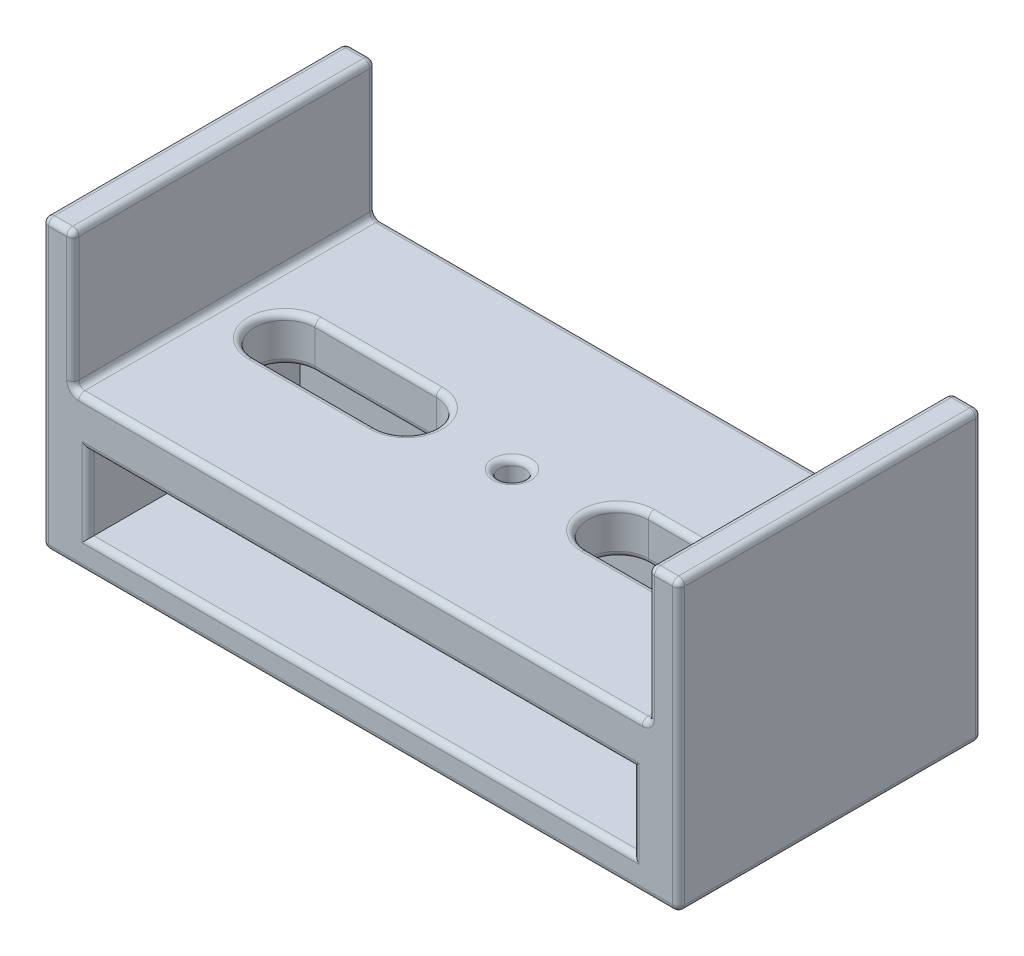
from build123d import *

# Parameters (mm, degrees)
SKETCH_1_W          = 210
SKETCH_1_H          = 100
EXTRUDE_1_DEPTH     = 50
CUT_EXTRUDE_1_DEPTH = 40
SKETCH_3_W          = 180
SKETCH_3_H          = 25
CUT_EXTRUDE_2_DEPTH = 70
SKETCH_4_R          = 4.25
CUT_EXTRUDE_3_DEPTH = 20
FILLET_4_R          = 2
SKETCH_6_W          = 10
SKETCH_6_H          = 100
EXTRUDE_2_DEPTH     = 45
FILLET_7_R          = 2


with BuildPart() as part:
    # 草图1 → 凸台-拉伸1 (new body)
    with BuildSketch(Plane(origin=(0, 0, 0), x_dir=(1, 0, 0), z_dir=(0, 1, 0))):
        with Locations((105, -50)):
            Rectangle(SKETCH_1_W, SKETCH_1_H)
    extrude(amount=EXTRUDE_1_DEPTH)

    # 草图2 → 切除-拉伸1 (cut)
    with BuildSketch(Plane(origin=(0, 50, 0), x_dir=(1, 0, 0), z_dir=(0, 1, 0))):
        with BuildLine():
            Line((30, -40), (70, -40))
            ThreePointArc((70, -40), (80, -50), (70, -60))
            Line((70, -60), (30, -60))
            ThreePointArc((30, -60), (20, -50), (30, -40))
        make_face()
        with BuildLine():
            Line((140, -40), (180, -40))
            ThreePointArc((180, -40), (190, -50), (180, -60))
            Line((180, -60), (140, -60))
            ThreePointArc((140, -60), (130, -50), (140, -40))
        make_face()
    extrude(amount=-CUT_EXTRUDE_1_DEPTH, mode=Mode.SUBTRACT)

    # 草图3 → 切除-拉伸2 (cut)
    with BuildSketch(Plane.XY.offset(100)):
        with Locations((105, 22.5)):
            Rectangle(SKETCH_3_W, SKETCH_3_H)
    extrude(amount=-CUT_EXTRUDE_2_DEPTH, mode=Mode.SUBTRACT)

    # 草图4 → 切除-拉伸3 (cut)
    with BuildSketch(Plane(origin=(0, 50, 0), x_dir=(1, 0, 0), z_dir=(0, 1, 0))):
        with Locations((105, -50)):
            Circle(SKETCH_4_R)
    extrude(amount=-CUT_EXTRUDE_3_DEPTH, mode=Mode.SUBTRACT)

    # 圆角4
    fillet_4_edges = [part.edges().sort_by_distance(p)[0] for p in [
        (190, 50, 50),
        (160, 50, 60),
        (130, 50, 50),
        (130, 35, 50),
        (160, 35, 60),
        (190, 35, 50),
        (80, 50, 50),
        (50, 50, 60),
        (20, 50, 50),
        (20, 35, 50),
        (50, 35, 60),
        (80, 35, 50),
        (160, 50, 40),
        (160, 35, 40),
        (50, 50, 40),
        (50, 35, 40),
        (100.75, 35, 50),
        (100.75, 50, 50),
    ]]
    fillet(fillet_4_edges, radius=FILLET_4_R)

    # 草图6 → 凸台-拉伸2 (add)
    with BuildSketch(Plane(origin=(0, 50, 0), x_dir=(1, 0, 0), z_dir=(0, 1, 0))):
        with Locations((205, -50)):
            Rectangle(SKETCH_6_W, SKETCH_6_H)
        with Locations((5, -50)):
            Rectangle(SKETCH_6_W, SKETCH_6_H)
    extrude(amount=EXTRUDE_2_DEPTH)

    # 圆角7
    fillet_7_edges = [part.edges().sort_by_distance(p)[0] for p in [
        (0, 95, 50),
        (0, 0, 50),
        (210, 95, 50),
        (210, 0, 50),
        (200, 95, 50),
        (200, 50, 50),
        (10, 95, 50),
        (10, 50, 50),
        (210, 47.5, 0),
        (205, 95, 0),
        (200, 72.5, 0),
        (105, 50, 0),
        (10, 72.5, 0),
        (5, 95, 0),
        (0, 47.5, 0),
        (105, 0, 0),
        (0, 47.5, 100),
        (5, 95, 100),
        (10, 72.5, 100),
        (105, 50, 100),
        (200, 72.5, 100),
        (205, 95, 100),
        (210, 47.5, 100),
        (105, 0, 100),
        (195, 22.5, 100),
        (105, 35, 100),
        (15, 22.5, 100),
        (105, 10, 100),
    ]]
    fillet(fillet_7_edges, radius=FILLET_7_R)


solid = part.part
